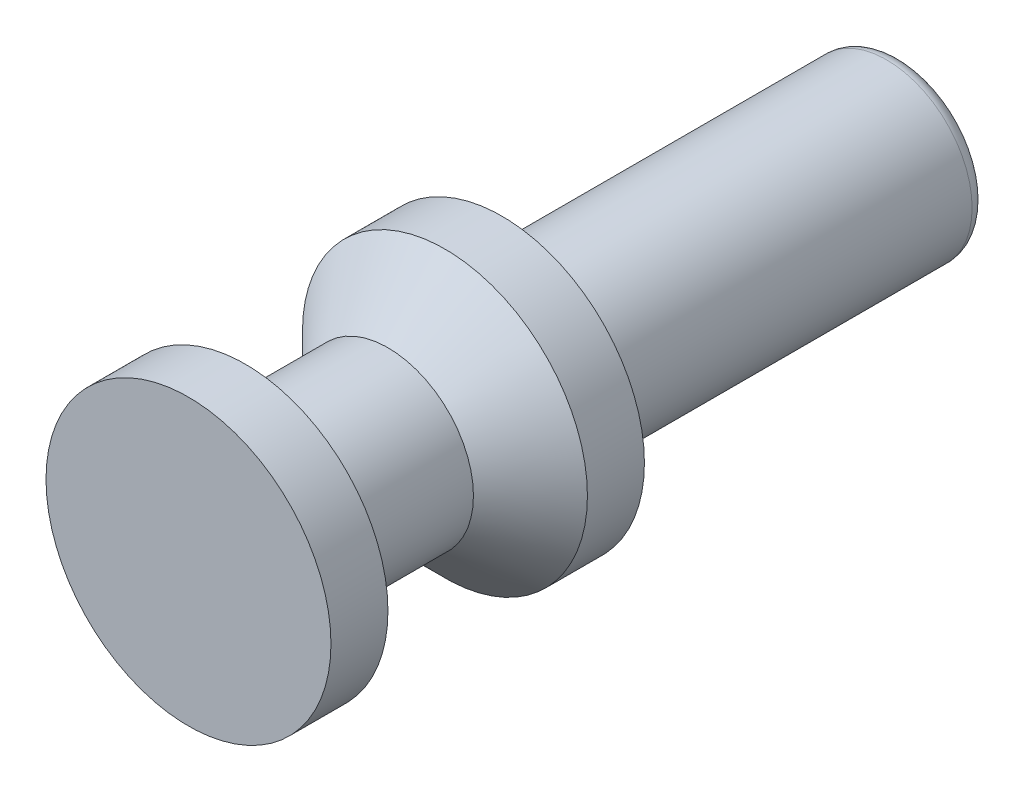
from build123d import *

# Parameters (mm, degrees)
SKETCH1_R           = 1.5
BOSS_EXTRUDE1_DEPTH = 12.5
SKETCH2_R           = 2.5
BOSS_EXTRUDE2_DEPTH = 1
FILLET1_R           = 0.25
BOSS_EXTRUDE4_START = -4.5
SKETCH4_R           = 2.5
BOSS_EXTRUDE4_DEPTH = 1
CHAMFER2_SIZE       = 1


with BuildPart() as part:
    # Sketch1 → Boss-Extrude1 (new body)
    with BuildSketch(Plane.XY):
        Circle(SKETCH1_R)
    extrude(amount=BOSS_EXTRUDE1_DEPTH)

    # Sketch2 → Boss-Extrude2 (add)
    with BuildSketch(Plane.XY.offset(12.5)):
        Circle(SKETCH2_R)
    extrude(amount=-BOSS_EXTRUDE2_DEPTH)

    # Fillet1
    fillet1_edges = [part.edges().sort_by_distance(p)[0] for p in [
        (-1.5, 0, 0),
    ]]
    fillet(fillet1_edges, radius=FILLET1_R)

    # Sketch4 → Boss-Extrude4 (add)
    with BuildSketch(Plane.XY.offset(12.5).offset(BOSS_EXTRUDE4_START)):
        Circle(SKETCH4_R)
    extrude(amount=-BOSS_EXTRUDE4_DEPTH)

    # Chamfer2
    chamfer2_edges = [part.edges().sort_by_distance(p)[0] for p in [
        (-1.5, 0, 8),
    ]]
    chamfer(chamfer2_edges, length=CHAMFER2_SIZE - 0.0001)  # a hair under: the kernel refuses the full size


solid = part.part
